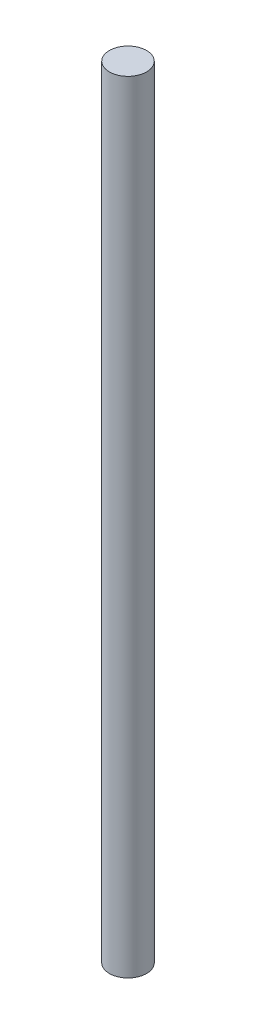
from build123d import *

# Parameters (mm, degrees)
SKETCH1_R           = 5
BOSS_EXTRUDE1_DEPTH = 210


with BuildPart() as part:
    # Sketch1 → Boss-Extrude1 (new body)
    with BuildSketch(Plane(origin=(0, 0, 0), x_dir=(1, 0, 0), z_dir=(0, 1, 0))):
        Circle(SKETCH1_R)
    extrude(amount=BOSS_EXTRUDE1_DEPTH)


solid = part.part
